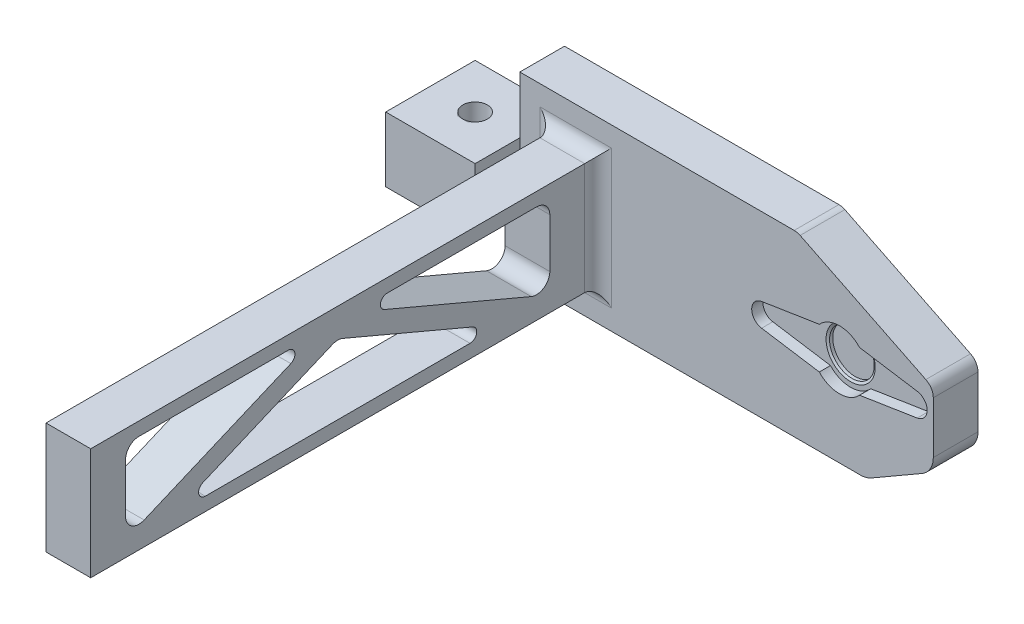
from build123d import *

# Parameters (mm, degrees)
SKETCH3_W            = 92.5
SKETCH3_H            = 40
BOSS_EXTRUDE1_DEPTH  = 10
CUT_EXTRUDE1_DEPTH   = 2.5
SKETCH21_W           = 10
SKETCH21_H           = 25
BOSS_EXTRUDE11_DEPTH = 113.5
FILLET1_R            = 3
CUT_EXTRUDE2_DEPTH   = 144.203526493
FILLET4_R            = 3
FILLET5_R            = 1.5
SKETCH25_W           = 20
SKETCH25_H           = 14.5
BOSS_EXTRUDE12_DEPTH = 20
M5_CLEARANCE_HOLE1_D = 5.5
CHAMFER1_SIZE        = 15
CHAMFER1_SIZE2       = 30.41699103
CHAMFER2_SIZE        = 15
CHAMFER2_SIZE2       = 8.660254038
FILLET6_R            = 3
FILLET7_R            = 5
SKETCH28_R           = 5
CUT_EXTRUDE3_DEPTH   = 1
CHAMFER3_SIZE        = 0.5
CHAMFER3_SIZE2       = 0.288675135
SPLIT1_START         = -7.25
SPLIT1_DEPTH         = 14.5
SPLIT1_2_DEPTH       = 14.5
SPLIT1_3_DEPTH       = 14.5


# Read off the part's stored shape, not the designer's step: Split1
with BuildPart() as part:
    # Sketch3 → Boss-Extrude1 (new body)
    with BuildSketch(Plane.XY):
        Rectangle(SKETCH3_W, SKETCH3_H)
    extrude(amount=-BOSS_EXTRUDE1_DEPTH)

    # Sketch2 → Cut-Extrude1 (cut)
    with BuildSketch(Plane.XY):
        with BuildLine():
            Line((7.842480092, 2.593174218), (20.7479962, 4.621288911))
            ThreePointArc((20.7479962, 4.621288911), (25.25, 6.593267506), (29.7520038, 4.621288911))
            Line((29.7520038, 4.621288911), (42.657519908, 2.593174218))
            ThreePointArc((42.657519908, 2.593174218), (44.875, 0), (42.657519908, -2.593174218))
            Line((42.657519908, -2.593174218), (29.7520038, -4.621288911))
            ThreePointArc((29.7520038, -4.621288911), (25.25, -6.593267506), (20.7479962, -4.621288911))
            Line((20.7479962, -4.621288911), (7.842480092, -2.593174218))
            ThreePointArc((7.842480092, -2.593174218), (5.625, 0), (7.842480092, 2.593174218))
        make_face()
    extrude(amount=-CUT_EXTRUDE1_DEPTH, mode=Mode.SUBTRACT)

    # Sketch21 → Boss-Extrude11 (add)
    with BuildSketch(Plane.XY):
        with Locations((-33.75, 0)):
            Rectangle(SKETCH21_W, SKETCH21_H)
    extrude(amount=BOSS_EXTRUDE11_DEPTH)

    # Fillet1
    fillet1_edges = [part.edges().sort_by_distance(p)[0] for p in [
        (-28.75, 0, 0),
        (-33.75, 12.5, 0),
        (-38.75, 0, 0),
        (-33.75, -12.5, 0),
    ]]
    fillet(fillet1_edges, radius=FILLET1_R)

    # Sketch24 → Cut-Extrude2 (cut, through all)
    with BuildSketch(Plane.ZY.offset(38.75)):
        Polygon((95.25, -9.5), (21.25, -9.5), (58.25, 6.167532718), align=None)
        Polygon((54.57929411, 9.5), (10.790027833, -9.042426002), (10.790027833, 9.5), align=None)
        Polygon((61.92070589, 9.5), (105.709972167, 9.5), (105.709972167, -9.042426002), align=None)
    extrude(amount=-CUT_EXTRUDE2_DEPTH, mode=Mode.SUBTRACT)

    # Fillet4
    fillet4_edges = [part.edges().sort_by_distance(p)[0] for p in [
        (-33.75, 9.5, 10.790027833),
        (-33.75, -9.042426002, 10.790027833),
        (-33.75, -9.042426002, 105.709972167),
        (-33.75, 9.5, 105.709972167),
        (-33.75, 6.167532718, 58.25),
    ]]
    fillet(fillet4_edges, radius=FILLET4_R)

    # Fillet5
    fillet5_edges = [part.edges().sort_by_distance(p)[0] for p in [
        (-33.75, 9.5, 54.57929411),
        (-33.75, 9.5, 61.92070589),
        (-33.75, -9.5, 95.25),
        (-33.75, -9.5, 21.25),
    ]]
    fillet(fillet5_edges, radius=FILLET5_R)

    # Sketch25 → Boss-Extrude12 (add)
    with BuildSketch(Plane.ZY.offset(46.25)):
        Rectangle(SKETCH25_W, SKETCH25_H)
    extrude(amount=BOSS_EXTRUDE12_DEPTH)

    # M5 Clearance Hole1 (through all)
    with Locations(Plane(origin=(0, 7.25, 0), x_dir=(1, 0, 0), z_dir=(0, 1, 0))):
        with Locations((-56.25, 0)):
            Hole(M5_CLEARANCE_HOLE1_D / 2)

    # Chamfer1
    chamfer1_edges = [part.edges().sort_by_distance(p)[0] for p in [
        (46.25, 20, -5),
    ]]
    chamfer1_side = [part.faces().sort_by_distance(p)[0] for p in [
        (46.25, 0, -5),
    ]]
    chamfer(chamfer1_edges, length=CHAMFER1_SIZE, length2=CHAMFER1_SIZE2, reference=chamfer1_side[0])

    # Chamfer2
    chamfer2_edges = [part.edges().sort_by_distance(p)[0] for p in [
        (46.25, -20, -5),
    ]]
    chamfer2_side = [part.faces().sort_by_distance(p)[0] for p in [
        (0, -20, -5),
    ]]
    chamfer(chamfer2_edges, length=CHAMFER2_SIZE, length2=CHAMFER2_SIZE2, reference=chamfer2_side[0])

    # Fillet6
    fillet6_edges = [part.edges().sort_by_distance(p)[0] for p in [
        (46.25, 5, -5),
        (15.83300897, 20, -5),
    ]]
    fillet(fillet6_edges, radius=FILLET6_R)

    # Fillet7
    fillet7_edges = [part.edges().sort_by_distance(p)[0] for p in [
        (31.25, -20, -5),
        (46.25, -11.339745962, -5),
    ]]
    fillet(fillet7_edges, radius=FILLET7_R)

    # Sketch28 → Cut-Extrude3 (cut)
    with BuildSketch(Plane.XY.offset(-2.5)):
        with Locations((25.25, 0)):
            Circle(SKETCH28_R)
    extrude(amount=-CUT_EXTRUDE3_DEPTH, mode=Mode.SUBTRACT)

    # Chamfer3
    chamfer3_edges = [part.edges().sort_by_distance(p)[0] for p in [
        (20.25, 0, -2.5),
    ]]
    chamfer3_side = [part.faces().sort_by_distance(p)[0] for p in [
        (14.359518991, -3.198192821, -2.5),
    ]]
    chamfer(chamfer3_edges, length=CHAMFER3_SIZE, length2=CHAMFER3_SIZE2, reference=chamfer3_side[0])

    # Split1 2 outline → Split1 2 (cut)
    with BuildSketch(Plane(origin=(0, 0, 0), x_dir=(1, 0, 0), z_dir=(0, 1, 0)).offset(SPLIT1_START)):
        with BuildLine():
            ThreePointArc((-56.25, -2.75), (-57.302379439, -2.540668714), (-58.194543648, -1.944543648))
            Line((-58.194543648, -1.944543648), (-57.389087297, -2.75))
            Line((-57.389087297, -2.75), (-56.25, -2.75))
        make_face()
        with BuildLine():
            ThreePointArc((-54.305456352, -1.944543648), (-55.197620561, -2.540668714), (-56.25, -2.75))
            Line((-56.25, -2.75), (-55.110912703, -2.75))
            Line((-55.110912703, -2.75), (-54.305456352, -1.944543648))
        make_face()
    extrude(amount=SPLIT1_2_DEPTH, mode=Mode.SUBTRACT)


with BuildPart() as body_2:
    # Split1 outline → Split1 (new body)
    with BuildSketch(Plane(origin=(0, 0, 0), x_dir=(1, 0, 0), z_dir=(0, 1, 0)).offset(SPLIT1_START)):
        with BuildLine():
            Line((-58.194543648, -1.944543648), (-57.389087297, -2.75))
            Line((-57.389087297, -2.75), (-56.25, -2.75))
            ThreePointArc((-56.25, -2.75), (-57.302379439, -2.540668714), (-58.194543648, -1.944543648))
        make_face()
    extrude(amount=SPLIT1_DEPTH)


with BuildPart() as body_3:
    # Split1 3 outline → Split1 3 (new body)
    with BuildSketch(Plane(origin=(0, 0, 0), x_dir=(1, 0, 0), z_dir=(0, 1, 0)).offset(SPLIT1_START)):
        with BuildLine():
            Line((-56.25, -2.75), (-55.110912703, -2.75))
            Line((-55.110912703, -2.75), (-54.305456352, -1.944543648))
            ThreePointArc((-54.305456352, -1.944543648), (-55.197620561, -2.540668714), (-56.25, -2.75))
        make_face()
    extrude(amount=SPLIT1_3_DEPTH)


solid = Compound([part.part, body_2.part, body_3.part])
